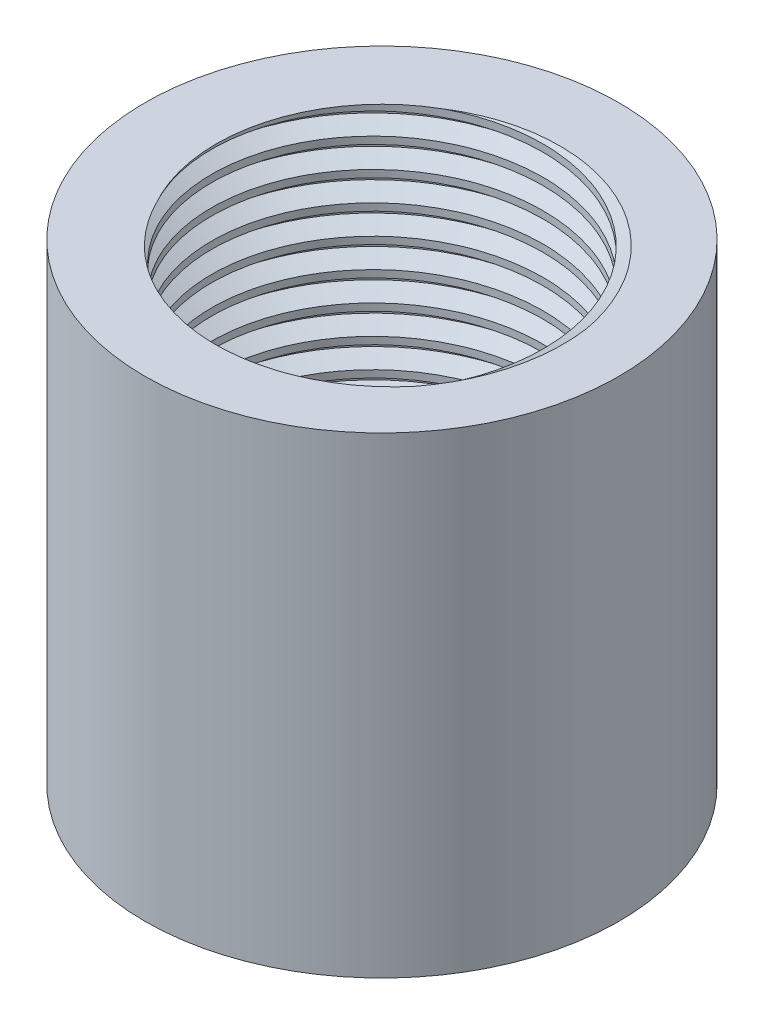
from build123d import *

# Parameters (mm, degrees)
SKETCH1_R           = 12.3
SKETCH1_R_2         = 8.6
BOSS_EXTRUDE1_DEPTH = 20
BOSS_EXTRUDE2_START = -4.5
SKETCH3_R           = 12.3
BOSS_EXTRUDE2_DEPTH = 4.5
SKETCH4_R           = 4.25
CUT_EXTRUDE1_DEPTH  = 31.047129647
SKETCH5_R           = 6.85
CUT_EXTRUDE2_DEPTH  = 1
THREAD1_PITCH       = 1.5


with BuildPart() as part:
    # Sketch1 → Boss-Extrude1 (new body)
    with BuildSketch(Plane(origin=(0, 0, 0), x_dir=(1, 0, 0), z_dir=(0, 1, 0))):
        with Locations(Location((0, 0, 0), (0, 0, 270))):
            Circle(SKETCH1_R)
        with Locations(Location((0, 0, 0), (0, 0, 270))):
            Circle(SKETCH1_R_2, mode=Mode.SUBTRACT)
    extrude(amount=BOSS_EXTRUDE1_DEPTH)

    # Sketch3 → Boss-Extrude2 (add)
    with BuildSketch(Plane(origin=(0, 0, 0), x_dir=(1, 0, 0), z_dir=(0, 1, 0)).offset(BOSS_EXTRUDE2_START)):
        with Locations(Location((0, 0, 0), (0, 0, 270))):
            Circle(SKETCH3_R)
    extrude(amount=BOSS_EXTRUDE2_DEPTH)

    # Sketch4 → Cut-Extrude1 (cut, through all)
    with BuildSketch(Plane.XZ.offset(4.5)):
        with Locations(Location((0, 0, 0), (0, 0, 270))):
            Circle(SKETCH4_R)
    extrude(amount=-CUT_EXTRUDE1_DEPTH, mode=Mode.SUBTRACT)

    # Sketch5 → Cut-Extrude2 (cut)
    with BuildSketch(Plane.XZ.offset(4.5)):
        with Locations(Location((0, 0, 0), (0, 0, 270))):
            Circle(SKETCH5_R)
    extrude(amount=-CUT_EXTRUDE2_DEPTH, mode=Mode.SUBTRACT)

    # Thread1: the profile of Thread Profile1 profile screwed along a right-hand helix of 13.333333 turns, 8 arcs to a turn; built about Z, then put on its axis
    thread1_z = Axis((0, 0, 0), (0, 0, 1))
    thread1_corners = [(8.5997, 0, -0.000173205), (9.411898813, 0, 0.468749998), (9.411898813, 0, 0.656249998), (8.5997, 0, 1.125173201)]
    with BuildLine(mode=Mode.PRIVATE) as thread1_profile:
        Line(thread1_corners[0], thread1_corners[1])
        Line(thread1_corners[1], thread1_corners[2])
        Line(thread1_corners[2], thread1_corners[3])
        Line(thread1_corners[3], thread1_corners[0])
    thread1_cap = Face(thread1_profile.wire())
    thread1_turn_angles = [0, 22.5, 45, 67.5, 90, 112.5, 135, 157.5, 180, 202.5, 225, 247.5, 270, 292.5, 315, 337.5, 360]
    thread1_turn_weights = [1, 0.9238795325112867, 1, 0.9238795325112867, 1, 0.9238795325112867, 1, 0.9238795325112867, 1, 0.9238795325112867, 1, 0.9238795325112867, 1, 0.9238795325112867, 1, 0.9238795325112867, 1]
    thread1_turn_rails = [Edge.make_bspline([Vector(p[0], p[1], 0).rotate(thread1_z, thread1_turn_angles[k]) / thread1_turn_weights[k] + Vector(0, 0, p[2] + THREAD1_PITCH * thread1_turn_angles[k] / 360) for k in range(17)], [0, 0, 0, 1, 1, 2, 2, 3, 3, 4, 4, 5, 5, 6, 6, 7, 7, 8, 8, 8], 2, thread1_turn_weights) for p in thread1_corners]
    thread1_turn_sides = [Face.make_surface_from_curves(thread1_turn_rails[p[0]], thread1_turn_rails[p[1]]) for p in [(0, 1), (1, 2), (2, 3), (3, 0)]]
    thread1_last_angles = [4680, 4702.5, 4725, 4747.5, 4770, 4785, 4800]
    thread1_last_weights = [1, 0.9238795325112867, 1, 0.9238795325112867, 1, 0.9659258262890703, 1]
    thread1_last_rails = [Edge.make_bspline([Vector(p[0], p[1], 0).rotate(thread1_z, thread1_last_angles[k]) / thread1_last_weights[k] + Vector(0, 0, p[2] + THREAD1_PITCH * thread1_last_angles[k] / 360) for k in range(7)], [0, 0, 0, 1, 1, 2, 2, 3, 3, 3], 2, thread1_last_weights) for p in thread1_corners]
    thread1_last_sides = [Face.make_surface_from_curves(thread1_last_rails[p[0]], thread1_last_rails[p[1]]) for p in [(0, 1), (1, 2), (2, 3), (3, 0)]]
    thread1 = Plane(origin=(0, 0, 0), x_dir=(1, 0, 0), z_dir=(0, 1, 0)) * Solid(Shell([*[p.moved(Location((0, 0, THREAD1_PITCH * i))) for i in range(13) for p in thread1_turn_sides], *thread1_last_sides, thread1_cap, thread1_cap.rotate(thread1_z, 4800).moved(Location((0, 0, THREAD1_PITCH * 4800 / 360)))]))
    add(thread1, mode=Mode.SUBTRACT)


solid = part.part
